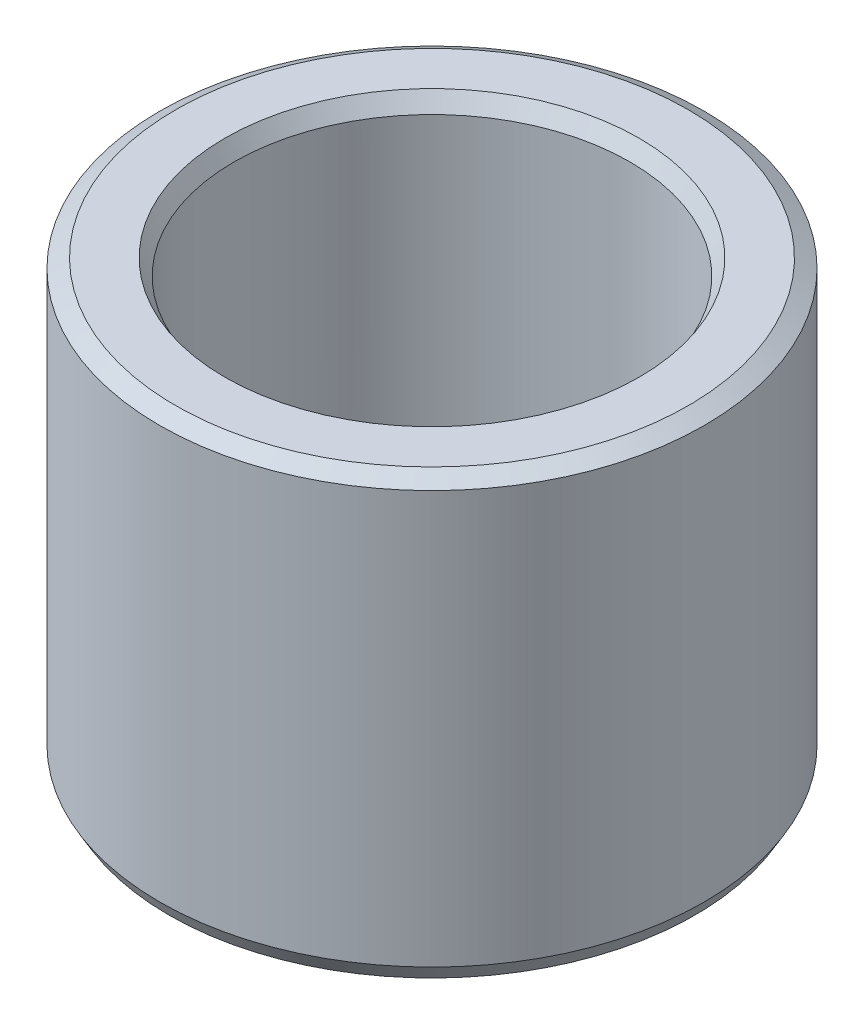
from build123d import *
from OCP.BRepFilletAPI import BRepFilletAPI_MakeChamfer

# Parameters (mm, degrees)
SKETCH1_R           = 50
BOSS_EXTRUDE1_DEPTH = 80.401691956
SKETCH2_R           = 36.340655727
CUT_EXTRUDE1_DEPTH  = 108.07208819
CHAMFER1_SIZE       = 1.691207982
CHAMFER1_SIZE2      = 2.929258151


with BuildPart() as part:
    # Sketch1 → Boss-Extrude1 (new body)
    with BuildSketch(Plane(origin=(0, 0, 0), x_dir=(1, 0, 0), z_dir=(0, 1, 0))):
        Circle(SKETCH1_R)
    extrude(amount=BOSS_EXTRUDE1_DEPTH)

    # Sketch2 → Cut-Extrude1 (cut, through all)
    with BuildSketch(Plane(origin=(0, 0, 0), x_dir=(1, 0, 0), z_dir=(0, 1, 0))):
        Circle(SKETCH2_R)
    extrude(amount=CUT_EXTRUDE1_DEPTH, mode=Mode.SUBTRACT)

    # Chamfer1: one chamfer whose edges measure the first distance from different faces: ONE call of the kernel's chamfer builder (chamfer() names one face for all edges)
    chamfer1_edges_1 = [part.edges().sort_by_distance(p)[0] for p in [
        (-36.340655727, 80.401691956, 0),
    ]]
    chamfer1_side_1 = [part.faces().sort_by_distance(p)[0] for p in [
        (-48.585786438, 80.401691956, 0),
    ]]
    chamfer1_edges_2 = [part.edges().sort_by_distance(p)[0] for p in [
        (-36.340655727, 0, 0),
    ]]
    chamfer1_side_2 = [part.faces().sort_by_distance(p)[0] for p in [
        (-36.340655727, 40.200845978, 0),
    ]]
    chamfer1_edges_3 = [part.edges().sort_by_distance(p)[0] for p in [
        (-50, 0, 0),
    ]]
    chamfer1_side_3 = [part.faces().sort_by_distance(p)[0] for p in [
        (-48.585786438, 0, 0),
    ]]
    chamfer1_edges_4 = [part.edges().sort_by_distance(p)[0] for p in [
        (-50, 80.401691956, 0),
    ]]
    chamfer1_side_4 = [part.faces().sort_by_distance(p)[0] for p in [
        (-50, 40.200845978, 0),
    ]]
    chamfer1 = BRepFilletAPI_MakeChamfer(part.part.solid().wrapped)
    for e in chamfer1_edges_1:
        chamfer1.Add(CHAMFER1_SIZE, CHAMFER1_SIZE2, e.wrapped, chamfer1_side_1[0].wrapped)  # the first distance lies on this face
    for e in chamfer1_edges_2:
        chamfer1.Add(CHAMFER1_SIZE, CHAMFER1_SIZE2, e.wrapped, chamfer1_side_2[0].wrapped)  # the first distance lies on this face
    for e in chamfer1_edges_3:
        chamfer1.Add(CHAMFER1_SIZE, CHAMFER1_SIZE2, e.wrapped, chamfer1_side_3[0].wrapped)  # the first distance lies on this face
    for e in chamfer1_edges_4:
        chamfer1.Add(CHAMFER1_SIZE, CHAMFER1_SIZE2, e.wrapped, chamfer1_side_4[0].wrapped)  # the first distance lies on this face
    add(Compound.cast(chamfer1.Shape()), mode=Mode.REPLACE)


solid = part.part
